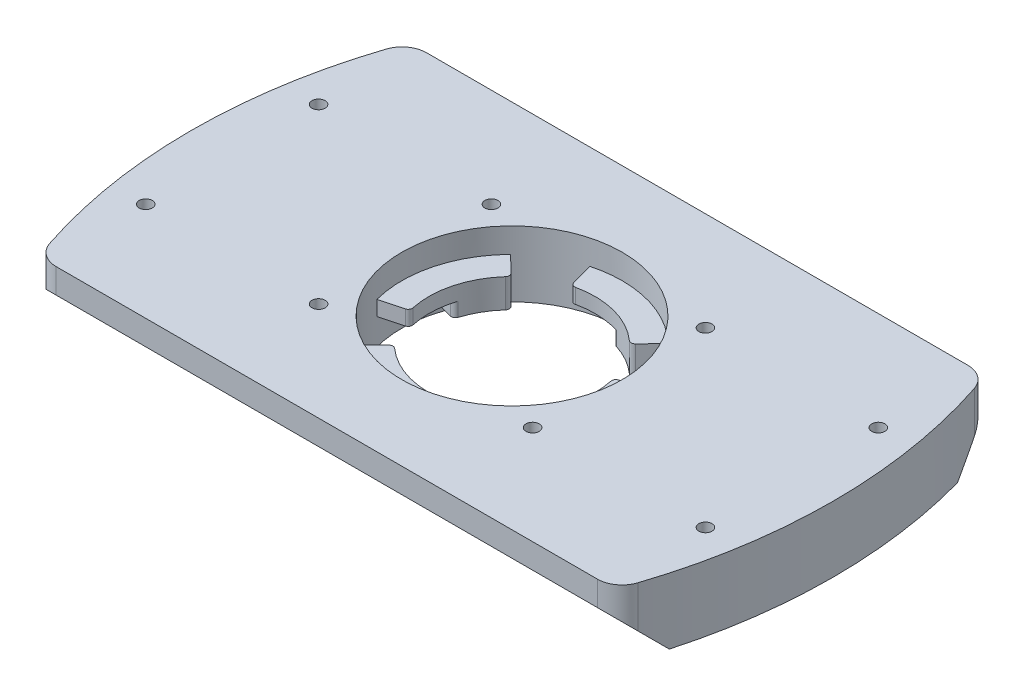
from build123d import *
from build123d.topology import SkipClean

# Parameters (mm, degrees)
EXTRUDE_1_DEPTH                  = 4
SKETCH_9_R                       = 13.4
CUT_EXTRUDE_1_DEPTH              = 46.730186967
FILLET_4_R                       = 3
CHAMFER_3_SIZE                   = 5
SKETCH_10_R                      = 3.9
EXTRUDE_8_DEPTH                  = 1
PATTERN_CIRCULAR_4_COUNT         = 4
EXTRUDE_START                    = -3.5
EXTRUDE_9_DEPTH                  = 3.5
CUT_EXTRUDE_2_DEPTH              = 1.7
FILLET_5_R                       = 0.5
PATTERN_CIRCULAR_5_COUNT         = 4
FILLET_5_OF_PATTERN_CIRCULAR_5_R = 0.5


with BuildPart() as part:
    # ｽｹｯﾁ2 → ﾎﾞｽ - 押し出し1 (new, symmetric)
    with BuildSketch(Plane(origin=(0, 0, 0), x_dir=(1, 0, 0), z_dir=(0, 1, 0))):
        with BuildLine():
            Line((-35, 22.5), (35, 22.5))
            ThreePointArc((35, 22.5), (39, 0), (35, -22.5))
            Line((35, -22.5), (-35, -22.5))
            ThreePointArc((-35, -22.5), (-39, 0), (-35, 22.5))
        make_face()
    extrude(amount=EXTRUDE_1_DEPTH, both=True)

    # ｽｹｯﾁ9 → ｶｯﾄ - 押し出し1 (cut, through all)
    with BuildSketch(Plane.XZ.offset(4)):
        with Locations(Location((0, 0, 0), (0, 0, 270))):
            Circle(SKETCH_9_R)
    extrude(amount=-CUT_EXTRUDE_1_DEPTH, mode=Mode.SUBTRACT)

    # ﾌｨﾚｯﾄ4
    fillet_4_edges = [part.edges().sort_by_distance(p)[0] for p in [
        (-35, 0, -22.5),
        (35, 0, -22.5),
        (35, 0, 22.5),
        (-35, 0, 22.5),
    ]]
    fillet(fillet_4_edges, radius=FILLET_4_R)

    # 面取り3
    # the kernel refuses this chamfer: 5 mm, written as the material it takes off along each edge
    with BuildSketch(Plane(origin=(-45.727009416, -4, -22.5), x_dir=(0, -0.027495876610586317, 0.9996219169112968), z_dir=(1, 0, 0))) as chamfer_3_piece_1:
        Polygon((CHAMFER_3_SIZE * 0.999621916911, -CHAMFER_3_SIZE * 0.0274958766106), (-CHAMFER_3_SIZE * 0.0274958766106, -CHAMFER_3_SIZE * 0.999621916911), (0, 0), align=None)
    extrude(amount=91.454018832, mode=Mode.SUBTRACT)
    with BuildSketch(Plane(origin=(45.727009416, -4, 22.5), x_dir=(0, 0.9996219169112968, 0.027495876610586317), z_dir=(-1, 0, 0))) as chamfer_3_piece_2:
        Polygon((CHAMFER_3_SIZE * 0.999621916911, CHAMFER_3_SIZE * 0.0274958766106), (-CHAMFER_3_SIZE * 0.0274958766106, CHAMFER_3_SIZE * 0.999621916911), (0, 0), align=None)
    extrude(amount=91.454018832, mode=Mode.SUBTRACT)

    # ｽｹｯﾁ10 → ﾎﾞｽ - 押し出し8 (add)
    with BuildSketch(Plane.XZ.offset(4)):
        with Locations(Location((-23.5, 0, 0), (0, 0, 90))):
            Circle(SKETCH_10_R)
    extrude_8 = extrude(amount=EXTRUDE_8_DEPTH)

    # ｽｹｯﾁ12 → M2 ねじ穴1 (revolve, cut)
    with BuildSketch(Plane(origin=(-13, -4, 10.5), x_dir=(0, 0, -1), z_dir=(1, 0, 0))):
        Polygon((0, 0), (0, 10.480688495), (0.8, 10), (0.8, 0), align=None)
    hole_wizard_m2_1 = revolve(axis=Axis((-13, -10.35, 10.5), (0, 1, 0)), mode=Mode.SUBTRACT)

    # 円形ﾊﾟﾀｰﾝ4: M2 ねじ穴1 ×4 about axis
    pattern_circular_4_axis = Axis((-23.5, 0, 0), (0, 1, 0))
    for i in range(1, PATTERN_CIRCULAR_4_COUNT):
        add(hole_wizard_m2_1.rotate(pattern_circular_4_axis, i * 360 / PATTERN_CIRCULAR_4_COUNT), mode=Mode.SUBTRACT)

    # ﾐﾗｰ3: ﾎﾞｽ - 押し出し8, M2 ねじ穴1 across plane
    add(extrude_8.mirror(Plane(origin=(0, 0, 0), x_dir=(0, 0, 1), z_dir=(1, 0, 0))))
    add(hole_wizard_m2_1.mirror(Plane(origin=(0, 0, 0), x_dir=(0, 0, 1), z_dir=(1, 0, 0))), mode=Mode.SUBTRACT)

    # ﾐﾗｰ3 copy 1 sketch → ﾐﾗｰ3 copy 1 (revolve, cut)
    with BuildSketch(Plane(origin=(13, -4, -10.5), x_dir=(1, 0, 0), z_dir=(0, 0, -1))):
        Polygon((0, 0), (0, -10.480688495), (0.8, -10), (0.8, 0), align=None)
    revolve(axis=Axis((13, -10.35, -10.5), (0, -1, 0)), mode=Mode.SUBTRACT)

    # ﾐﾗｰ3 copy 2 sketch → ﾐﾗｰ3 copy 2 (revolve, cut)
    with BuildSketch(Plane(origin=(34, -4, -10.5), x_dir=(0, 0, 1), z_dir=(1, 0, 0))):
        Polygon((0, 0), (0, -10.480688495), (0.8, -10), (0.8, 0), align=None)
    revolve(axis=Axis((34, -10.35, -10.5), (0, -1, 0)), mode=Mode.SUBTRACT)

    # ﾐﾗｰ3 copy 3 sketch → ﾐﾗｰ3 copy 3 (revolve, cut)
    with BuildSketch(Plane(origin=(34, -4, 10.5), x_dir=(-1, 0, 0), z_dir=(0, 0, 1))):
        Polygon((0, 0), (0, -10.480688495), (0.8, -10), (0.8, 0), align=None)
    revolve(axis=Axis((34, -10.35, 10.5), (0, -1, 0)), mode=Mode.SUBTRACT)

    # ｽｹｯﾁ13 → ﾎﾞｽ - 押し出し9 (add)
    with BuildSketch(Plane(origin=(0, 1, 0), x_dir=(1, 0, 0), z_dir=(0, 1, 0)).offset(EXTRUDE_START)):
        with BuildLine():
            Line((-9.392184142, -9.557556019), (-7.079183569, -7.203829536))
            ThreePointArc((-7.079183569, -7.203829536), (-2.571479677, -9.767163983), (2.614072356, -9.755850846))
            Line((2.614072356, -9.755850846), (3.468175204, -12.943406072))
            ThreePointArc((3.468175204, -12.943406072), (-3.411666106, -12.958415581), (-9.392184142, -9.557556019))
        make_face()
    extrude_9 = extrude(amount=EXTRUDE_9_DEPTH)

    # ｽｹｯﾁ14 → ｶｯﾄ - 押し出し2 (cut)
    with BuildSketch(Plane.XZ.offset(2.5)):
        with BuildLine():
            Line((0, 0), (3.468175204, 12.943406072))
            ThreePointArc((3.468175204, 12.943406072), (0, 13.4), (-3.468175204, 12.943406072))
            Line((-3.468175204, 12.943406072), (0, 0))
        make_face()
    cut_extrude_2 = extrude(amount=-CUT_EXTRUDE_2_DEPTH, mode=Mode.SUBTRACT)

    # ﾌｨﾚｯﾄ5
    fillet_5_edges = [part.edges().sort_by_distance(p)[0] for p in [
        (-7.079183569, -0.75, 7.203829536),
        (2.614072356, 0.1, 9.755850846),
        (-2.614072356, -1.65, 9.755850846),
    ]]
    fillet(fillet_5_edges, radius=FILLET_5_R)

    # 円形ﾊﾟﾀｰﾝ5: ﾎﾞｽ - 押し出し9, ｶｯﾄ - 押し出し2 ×4 about axis
    with SkipClean():  # the faces are left unmerged after this step: merging them gives an invalid solid
        pattern_circular_5_axis = Axis((0, 0, 0), (0, 1, 0))
        add([extrude_9.rotate(pattern_circular_5_axis, i * 360 / PATTERN_CIRCULAR_5_COUNT) for i in range(1, PATTERN_CIRCULAR_5_COUNT)])
        add([cut_extrude_2.rotate(pattern_circular_5_axis, i * 360 / PATTERN_CIRCULAR_5_COUNT) for i in range(1, PATTERN_CIRCULAR_5_COUNT)], mode=Mode.SUBTRACT)

    # ﾌｨﾚｯﾄ5 of 円形ﾊﾟﾀｰﾝ5
    fillet_5_of_pattern_circular_5_edges = [part.edges().sort_by_distance(p)[0] for p in [
        (7.203829536, -0.75, 7.079183569),
        (9.755850846, 0.1, -2.614072356),
        (9.755850846, -1.65, 2.614072356),
        (7.079183569, -0.75, -7.203829536),
        (-2.614072356, 0.1, -9.755850846),
        (2.614072356, -1.65, -9.755850846),
        (-7.203829536, -0.75, -7.079183569),
        (-9.755850846, 0.1, 2.614072356),
        (-9.755850846, -1.65, -2.614072356),
    ]]
    fillet(fillet_5_of_pattern_circular_5_edges, radius=FILLET_5_OF_PATTERN_CIRCULAR_5_R)


solid = part.part
